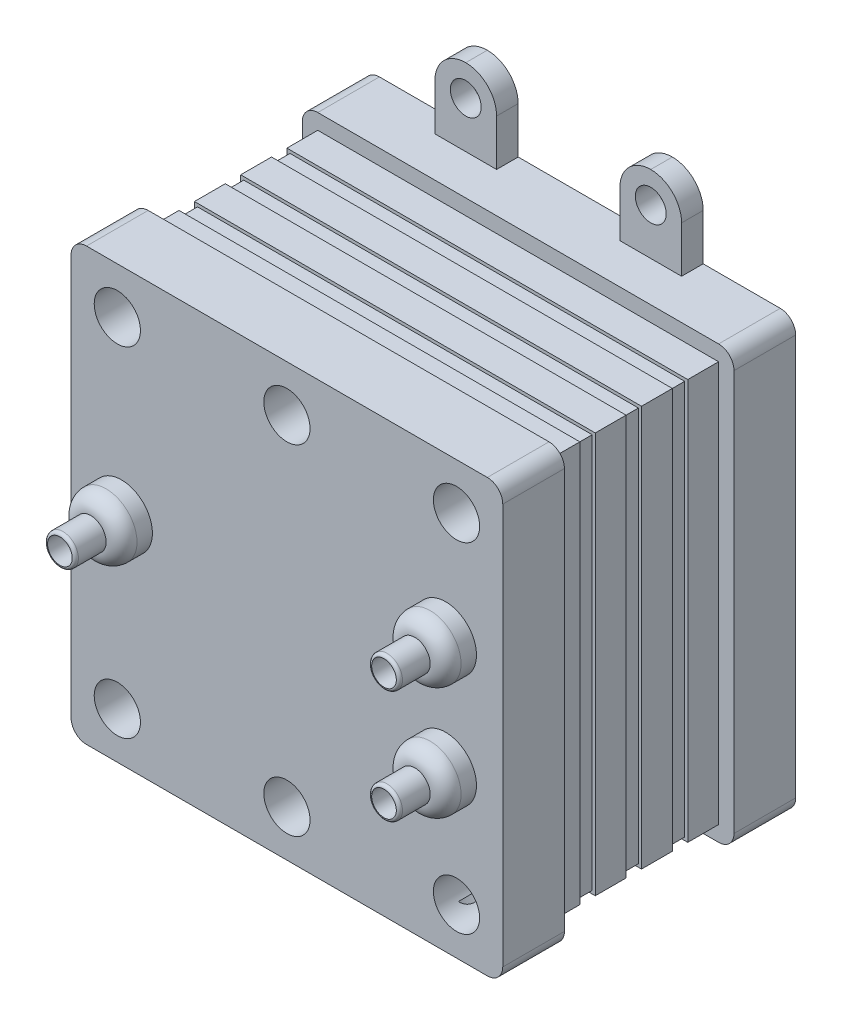
from build123d import *

# Parameters (mm, degrees)
BOSS_EXTRU_1_DEPTH      = 20
ESQUISSE2_W             = 130
ESQUISSE2_H             = 130
BOSS_EXTRU_2_DEPTH      = 10
ESQUISSE4_W             = 128
ESQUISSE4_H             = 128
BOSS_EXTRU_4_DEPTH      = 5
ESQUISSE5_W             = 130
ESQUISSE5_H             = 130
BOSS_EXTRU_5_DEPTH      = 10
ESQUISSE6_W             = 128
ESQUISSE6_H             = 128
BOSS_EXTRU_6_DEPTH      = 5
ESQUISSE7_W             = 130
ESQUISSE7_H             = 130
BOSS_EXTRU_7_DEPTH      = 10
ESQUISSE8_W             = 128
ESQUISSE8_H             = 128
BOSS_EXTRU_8_DEPTH      = 5
ESQUISSE9_W             = 130
ESQUISSE9_H             = 130
BOSS_EXTRU_9_DEPTH      = 10
BOSS_EXTRU_10_DEPTH     = 20
ESQUISSE11_R            = 7.5
ENL_V_MAT_EXTRU_1_DEPTH = 110
ESQUISSE12_R            = 10
BOSS_EXTRU_11_DEPTH     = 10
ESQUISSE13_R            = 5
BOSS_EXTRU_12_DEPTH     = 10
CONG_2_R                = 5
CONG_3_R                = 5
ESQUISSE14_R            = 4
ENL_V_MAT_EXTRU_2_DEPTH = 10
CONG_4_R                = 1
ESQUISSE15_R            = 5
ENL_V_MAT_EXTRU_3_DEPTH = 10
ESQUISSE16_W            = 20
ESQUISSE16_H            = 7
BOSS_EXTRU_13_DEPTH     = 25
CONG_5_R                = 10
ESQUISSE17_R            = 5
ENL_V_MAT_EXTRU_4_DEPTH = 25


with BuildPart() as part:
    # Esquisse1 → Boss.-Extru.1 (new body)
    with BuildSketch(Plane.XY):
        with BuildLine():
            Line((-74.463354037, 41.428571429), (55.536645963, 41.428571429))
            ThreePointArc((55.536645963, 41.428571429), (59.072179869, 39.964105335), (60.536645963, 36.428571429))
            Line((60.536645963, 36.428571429), (60.536645963, -93.571428571))
            ThreePointArc((60.536645963, -93.571428571), (59.072179869, -97.106962477), (55.536645963, -98.571428571))
            Line((55.536645963, -98.571428571), (-74.463354037, -98.571428571))
            ThreePointArc((-74.463354037, -98.571428571), (-77.998887943, -97.106962477), (-79.463354037, -93.571428571))
            Line((-79.463354037, -93.571428571), (-79.463354037, 36.428571429))
            ThreePointArc((-79.463354037, 36.428571429), (-77.998887943, 39.964105335), (-74.463354037, 41.428571429))
        make_face()
    extrude(amount=BOSS_EXTRU_1_DEPTH)

    # Esquisse2 → Boss.-Extru.2 (add)
    with BuildSketch(Plane.XY.offset(20)):
        with Locations((-9.463354037, -28.571428571)):
            Rectangle(ESQUISSE2_W, ESQUISSE2_H)
    extrude(amount=BOSS_EXTRU_2_DEPTH)

    # Esquisse4 → Boss.-Extru.4 (add)
    with BuildSketch(Plane.XY.offset(30)):
        with Locations((-9.463354037, -28.571428571)):
            Rectangle(ESQUISSE4_W, ESQUISSE4_H)
    extrude(amount=BOSS_EXTRU_4_DEPTH)

    # Esquisse5 → Boss.-Extru.5 (add)
    with BuildSketch(Plane.XY.offset(35)):
        with Locations((-9.463354037, -28.571428571)):
            Rectangle(ESQUISSE5_W, ESQUISSE5_H)
    extrude(amount=BOSS_EXTRU_5_DEPTH)

    # Esquisse6 → Boss.-Extru.6 (add)
    with BuildSketch(Plane.XY.offset(45)):
        with Locations((-9.463354037, -28.571428571)):
            Rectangle(ESQUISSE6_W, ESQUISSE6_H)
    extrude(amount=BOSS_EXTRU_6_DEPTH)

    # Esquisse7 → Boss.-Extru.7 (add)
    with BuildSketch(Plane.XY.offset(50)):
        with Locations((-9.463354037, -28.571428571)):
            Rectangle(ESQUISSE7_W, ESQUISSE7_H)
    extrude(amount=BOSS_EXTRU_7_DEPTH)

    # Esquisse8 → Boss.-Extru.8 (add)
    with BuildSketch(Plane.XY.offset(60)):
        with Locations((-9.463354037, -28.571428571)):
            Rectangle(ESQUISSE8_W, ESQUISSE8_H)
    extrude(amount=BOSS_EXTRU_8_DEPTH)

    # Esquisse9 → Boss.-Extru.9 (add)
    with BuildSketch(Plane.XY.offset(65)):
        with Locations((-9.463354037, -28.571428571)):
            Rectangle(ESQUISSE9_W, ESQUISSE9_H)
    extrude(amount=BOSS_EXTRU_9_DEPTH)

    # Esquisse10 → Boss.-Extru.10 (add)
    with BuildSketch(Plane.XY.offset(75)):
        with BuildLine():
            Line((55.536645963, -98.571428571), (-74.463354037, -98.571428571))
            ThreePointArc((-74.463354037, -98.571428571), (-77.998887943, -97.106962477), (-79.463354037, -93.571428571))
            Line((-79.463354037, -93.571428571), (-79.463354037, 36.428571429))
            ThreePointArc((-79.463354037, 36.428571429), (-77.998887943, 39.964105335), (-74.463354037, 41.428571429))
            Line((-74.463354037, 41.428571429), (55.536645963, 41.428571429))
            ThreePointArc((55.536645963, 41.428571429), (59.072179869, 39.964105335), (60.536645963, 36.428571429))
            Line((60.536645963, 36.428571429), (60.536645963, -93.571428571))
            ThreePointArc((60.536645963, -93.571428571), (59.072179869, -97.106962477), (55.536645963, -98.571428571))
        make_face()
    extrude(amount=BOSS_EXTRU_10_DEPTH)

    # Esquisse11 → Enlèv. mat.-Extru.1 (cut)
    with BuildSketch(Plane(origin=(0, 0, 0), x_dir=(-1, 0, 0), z_dir=(0, 0, -1))):
        with Locations((-45.536645963, 26.428571429)):
            Circle(ESQUISSE11_R)
        with Locations((9.463354037, 26.428571429)):
            Circle(ESQUISSE11_R)
        with Locations((64.463354037, 26.428571429)):
            Circle(ESQUISSE11_R)
        with Locations((64.463354037, -83.571428571)):
            Circle(ESQUISSE11_R)
        with Locations((9.463354037, -83.571428571)):
            Circle(ESQUISSE11_R)
        with Locations((-45.536645963, -83.571428571)):
            Circle(ESQUISSE11_R)
    extrude(amount=-ENL_V_MAT_EXTRU_1_DEPTH, mode=Mode.SUBTRACT)

    # Esquisse12 → Boss.-Extru.11 (add)
    with BuildSketch(Plane.XY.offset(95)):
        with Locations(Location((42.017899374, -10.231428571, 0), (0, 0, 180))):
            Circle(ESQUISSE12_R)
        with Locations(Location((42.017899374, -46.891428571, 0), (0, 0, 180))):
            Circle(ESQUISSE12_R)
        with Locations(Location((-63.089659674, -28.571428571, 0), (0, 0, 180))):
            Circle(ESQUISSE12_R)
    extrude(amount=BOSS_EXTRU_11_DEPTH)

    # Esquisse13 → Boss.-Extru.12 (add)
    with BuildSketch(Plane.XY.offset(105)):
        with Locations((42.017899374, -10.231428571)):
            Circle(ESQUISSE13_R)
        with Locations((42.017899374, -46.891428571)):
            Circle(ESQUISSE13_R)
        with Locations((-63.089659674, -28.571428571)):
            Circle(ESQUISSE13_R)
    extrude(amount=BOSS_EXTRU_12_DEPTH)

    # Congé2
    cong_2_edges = [part.edges().sort_by_distance(p)[0] for p in [
        (-53.089659674, -28.571428571, 105),
    ]]
    fillet(cong_2_edges, radius=CONG_2_R - 0.0001)  # a hair under: the kernel refuses the full size

    # Congé3
    cong_3_edges = [part.edges().sort_by_distance(p)[0] for p in [
        (52.017899374, -10.231428571, 105),
        (52.017899374, -46.891428571, 105),
    ]]
    fillet(cong_3_edges, radius=CONG_3_R - 0.0001)  # a hair under: the kernel refuses the full size

    # Esquisse14 → Enlèv. mat.-Extru.2 (cut)
    with BuildSketch(Plane.XY.offset(115)):
        with Locations((42.017899374, -10.231428571)):
            Circle(ESQUISSE14_R)
        with Locations((42.017899374, -46.891428571)):
            Circle(ESQUISSE14_R)
        with Locations((-63.089659674, -28.571428571)):
            Circle(ESQUISSE14_R)
    extrude(amount=-ENL_V_MAT_EXTRU_2_DEPTH, mode=Mode.SUBTRACT)

    # Congé4
    cong_4_edges = [part.edges().sort_by_distance(p)[0] for p in [
        (37.017899374, -10.231428571, 115),
        (37.017899374, -46.891428571, 115),
        (-68.089659674, -28.571428571, 115),
    ]]
    fillet(cong_4_edges, radius=CONG_4_R - 0.0001)  # a hair under: the kernel refuses the full size

    # Esquisse15 → Enlèv. mat.-Extru.3 (cut)
    with BuildSketch(Plane.XZ.offset(98.571428571)):
        with Locations(Location((-53.513533667, 9.422375375, 0), (0, 0, 270))):
            Circle(ESQUISSE15_R)
        with Locations(Location((36.486466333, 9.422375375, 0), (0, 0, 270))):
            Circle(ESQUISSE15_R)
        with Locations(Location((36.486466333, 85.188684339, 0), (0, 0, 270))):
            Circle(ESQUISSE15_R)
        with Locations(Location((-53.513533667, 85.188684339, 0), (0, 0, 270))):
            Circle(ESQUISSE15_R)
    extrude(amount=-ENL_V_MAT_EXTRU_3_DEPTH, mode=Mode.SUBTRACT)

    # Esquisse16 → Boss.-Extru.13 (add)
    with BuildSketch(Plane(origin=(0, 41.428571429, 0), x_dir=(1, 0, 0), z_dir=(0, 1, 0))):
        with Locations((-39.463354037, -3.5)):
            Rectangle(ESQUISSE16_W, ESQUISSE16_H)
        with Locations((20.536645963, -3.5)):
            Rectangle(ESQUISSE16_W, ESQUISSE16_H)
    extrude(amount=BOSS_EXTRU_13_DEPTH)

    # Congé5
    cong_5_edges = [part.edges().sort_by_distance(p)[0] for p in [
        (-49.463354037, 66.428571429, 3.5),
        (-29.463354037, 66.428571429, 3.5),
        (10.536645963, 66.428571429, 3.5),
        (30.536645963, 66.428571429, 3.5),
    ]]
    fillet(cong_5_edges, radius=CONG_5_R - 0.0001)  # a hair under: the kernel refuses the full size

    # Esquisse17 → Enlèv. mat.-Extru.4 (cut)
    with BuildSketch(Plane(origin=(0, 0, 0), x_dir=(-1, 0, 0), z_dir=(0, 0, -1))):
        with Locations((-20.536645963, 56.428571429)):
            Circle(ESQUISSE17_R)
        with Locations((39.463354037, 56.428571429)):
            Circle(ESQUISSE17_R)
    extrude(amount=-ENL_V_MAT_EXTRU_4_DEPTH, mode=Mode.SUBTRACT)


solid = part.part
